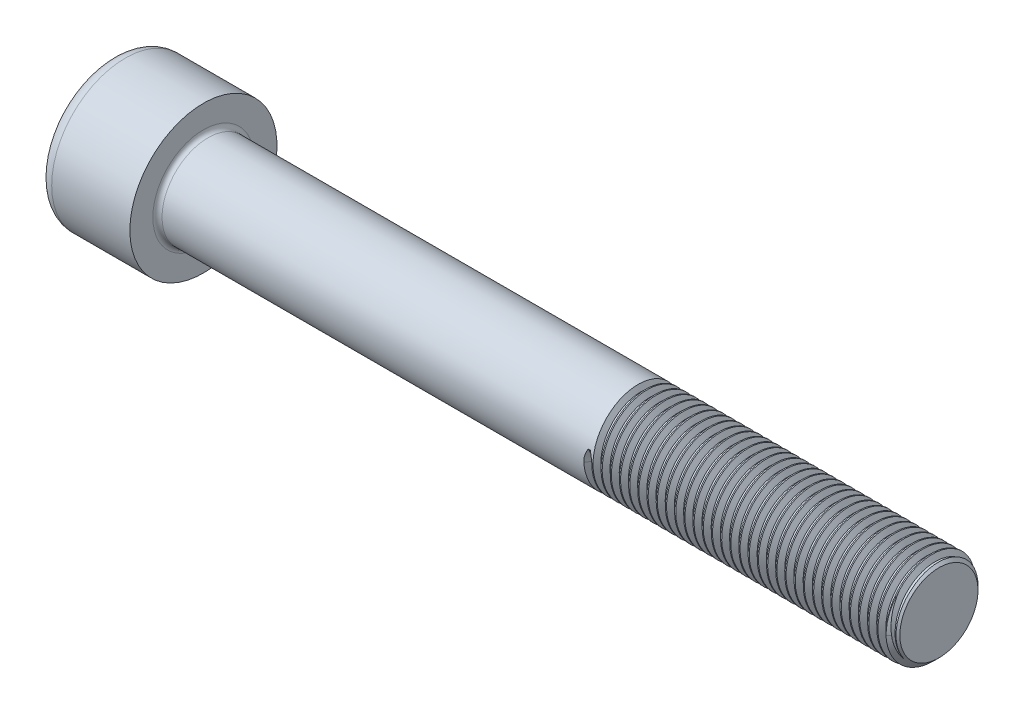
from build123d import *

# Parameters (mm, degrees)
CUT_EXTRUDE2_DEPTH = 5
THREAD1_PITCH      = 1


with BuildPart() as part:
    # Sketch1 → Revolve1 (revolve)
    with BuildSketch(Plane.XY, mode=Mode.PRIVATE) as revolve1_sk:
        with BuildLine():
            Line((0, 4), (0, 6.5))
            ThreePointArc((0, 6.5), (0.439339828, 7.560660172), (1.5, 8))
            Line((1.5, 8), (10, 8))
            Line((10, 8), (10, 5.5))
            ThreePointArc((10, 5.5), (10.146446609, 5.146446609), (10.5, 5))
            Line((10.5, 5), (89.25, 5))
            Line((89.25, 5), (90, 4.25))
            Line((90, 4.25), (90, 0))
            Line((90, 0), (7.309401077, 0))
            Line((7.309401077, 0), (5, 4))
            Line((5, 4), (0, 4))
        make_face()
    revolve(revolve1_sk.sketch.rotate(Axis((0, 0, 0), (1, 0, 0)), 90), axis=Axis((0, 0, 0), (1, 0, 0)))

    # Sketch2 → Cut-Extrude2 (cut)
    with BuildSketch(Plane.ZY):
        with BuildLine():
            Line((-3.464101488, 2.000000221), (-4.618802154, 0))
            Line((-4.618802154, 0), (-3.464101612, -2.000000006))
            ThreePointArc((-3.464101612, -2.000000006), (-4, 1.24e-07), (-3.464101488, 2.000000221))
        make_face()
        with BuildLine():
            ThreePointArc((1.7e-08, -4), (-1.99999999, -3.464101621), (-3.464101612, -2.000000006))
            Line((-3.464101612, -2.000000006), (-2.309401077, -4))
            Line((-2.309401077, -4), (1.7e-08, -4))
        make_face()
        with BuildLine():
            ThreePointArc((3.464101612, -2.000000006), (2.000000004, -3.464101613), (1.7e-08, -4))
            Line((1.7e-08, -4), (2.309401077, -4))
            Line((2.309401077, -4), (3.464101612, -2.000000006))
        make_face()
        with BuildLine():
            ThreePointArc((4, 0), (3.863703304, -1.035276184), (3.464101612, -2.000000006))
            Line((3.464101612, -2.000000006), (4.618802154, 0))
            Line((4.618802154, 0), (3.464101486, 2.000000224))
            ThreePointArc((3.464101486, 2.000000224), (3.863703272, 1.035276306), (4, 0))
        make_face()
        with BuildLine():
            Line((2.309401077, 4), (0, 4))
            ThreePointArc((0, 4), (1.999999888, 3.46410168), (3.464101486, 2.000000224))
            Line((3.464101486, 2.000000224), (2.309401077, 4))
        make_face()
        with BuildLine():
            Line((-2.309401077, 4), (-3.464101488, 2.000000221))
            ThreePointArc((-3.464101488, 2.000000221), (-1.999999889, 3.464101679), (0, 4))
            Line((0, 4), (-2.309401077, 4))
        make_face()
    extrude(amount=-CUT_EXTRUDE2_DEPTH, mode=Mode.SUBTRACT)

    # Thread1: the profile of Thread Profile1 profile screwed along a right-hand helix of 34 turns, 8 arcs to a turn; built about Z, then put on its axis
    thread1_z = Axis((0, 0, 0), (0, 0, 1))
    thread1_corners = [(5.0003, 0, -0.000173205), (5.0003, 0, 0.875173202), (4.458734125, 0, 0.562499999), (4.458734125, 0, 0.312499999)]
    with BuildLine(mode=Mode.PRIVATE) as thread1_profile:
        Line(thread1_corners[0], thread1_corners[1])
        Line(thread1_corners[1], thread1_corners[2])
        Line(thread1_corners[2], thread1_corners[3])
        Line(thread1_corners[3], thread1_corners[0])
    thread1_cap = Face(thread1_profile.wire())
    thread1_turn_angles = [0, 22.5, 45, 67.5, 90, 112.5, 135, 157.5, 180, 202.5, 225, 247.5, 270, 292.5, 315, 337.5, 360]
    thread1_turn_weights = [1, 0.9238795325112867, 1, 0.9238795325112867, 1, 0.9238795325112867, 1, 0.9238795325112867, 1, 0.9238795325112867, 1, 0.9238795325112867, 1, 0.9238795325112867, 1, 0.9238795325112867, 1]
    thread1_turn_rails = [Edge.make_bspline([Vector(p[0], p[1], 0).rotate(thread1_z, thread1_turn_angles[k]) / thread1_turn_weights[k] + Vector(0, 0, p[2] + THREAD1_PITCH * thread1_turn_angles[k] / 360) for k in range(17)], [0, 0, 0, 1, 1, 2, 2, 3, 3, 4, 4, 5, 5, 6, 6, 7, 7, 8, 8, 8], 2, thread1_turn_weights) for p in thread1_corners]
    thread1_turn_sides = [Face.make_surface_from_curves(thread1_turn_rails[p[0]], thread1_turn_rails[p[1]]) for p in [(0, 1), (1, 2), (2, 3), (3, 0)]]
    thread1 = Plane(origin=(91.25, 0, 0), x_dir=(0, 0, 1), z_dir=(-1, 0, 0)) * Solid(Shell([*[p.moved(Location((0, 0, THREAD1_PITCH * i))) for i in range(34) for p in thread1_turn_sides], thread1_cap, thread1_cap.rotate(thread1_z, 12240).moved(Location((0, 0, THREAD1_PITCH * 12240 / 360)))]))
    add(thread1, mode=Mode.SUBTRACT)

    # Sketch5 → Cut-Revolve1 (revolve, cut)
    with BuildSketch(Plane.XZ):
        Polygon((56.687500001, 4.458734125), (56.937500001, 4.458734125), (57.25, 5), (56.375000003, 5), align=None)
    revolve(axis=Axis((57.25, 0, 6.5), (-1, 0, 0)), mode=Mode.SUBTRACT)


solid = part.part
